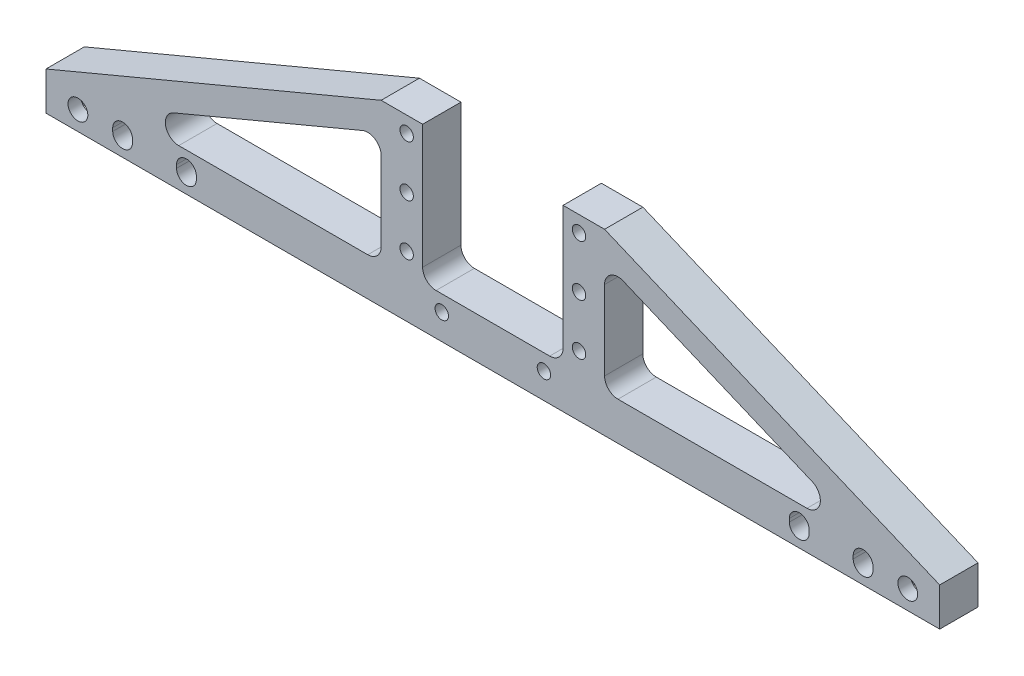
from build123d import *

# Parameters (mm, degrees)
SKETCH_1_R          = 1.05
SKETCH_1_R_2        = 1.55
EXTRUDE_1_DEPTH     = 6
SKETCH_2_R          = 1.55
CUT_EXTRUDE_1_DEPTH = 3
CUT_EXTRUDE_2_DEPTH = 75.242844773
CUT_EXTRUDE_3_DEPTH = 4
SKETCH_6_R          = 1.9
CUT_EXTRUDE_4_DEPTH = 3


with BuildPart() as part:
    # ｽｹｯﾁ1 → ﾎﾞｽ - 押し出し1 (new body)
    with BuildSketch(Plane.XY):
        with BuildLine():
            Line((-11, 4.6), (-11, 24))
            Line((-11, 24), (-17.5, 24))
            Line((-17.5, 24), (-70, 2))
            Line((-70, 2), (-70, -4))
            Line((-70, -4), (-17.5, -4))
            Line((-17.5, -4), (17.5, -4))
            Line((17.5, -4), (70, -4))
            Line((70, -4), (70, 2))
            Line((70, 2), (17.5, 24))
            Line((17.5, 24), (11, 24))
            Line((11, 24), (11, 4.6))
            ThreePointArc((11, 4.6), (10.38492424, 3.11507576), (8.9, 2.5))
            Line((8.9, 2.5), (-8.9, 2.5))
            ThreePointArc((-8.9, 2.5), (-10.38492424, 3.11507576), (-11, 4.6))
        make_face()
        with Locations((-13.5, 5.5)):
            Circle(SKETCH_1_R, mode=Mode.SUBTRACT)
        with Locations((-8, 0)):
            Circle(SKETCH_1_R, mode=Mode.SUBTRACT)
        with Locations((8, 0)):
            Circle(SKETCH_1_R, mode=Mode.SUBTRACT)
        with Locations((-13.5, 13.5)):
            Circle(SKETCH_1_R, mode=Mode.SUBTRACT)
        with Locations((-13.5, 21.5)):
            Circle(SKETCH_1_R, mode=Mode.SUBTRACT)
        with Locations((13.5, 21.5)):
            Circle(SKETCH_1_R, mode=Mode.SUBTRACT)
        with Locations((13.5, 13.5)):
            Circle(SKETCH_1_R, mode=Mode.SUBTRACT)
        with Locations((13.5, 5.5)):
            Circle(SKETCH_1_R, mode=Mode.SUBTRACT)
        with Locations((-65, -1)):
            Circle(SKETCH_1_R_2, mode=Mode.SUBTRACT)
        with Locations((65, -1)):
            Circle(SKETCH_1_R_2, mode=Mode.SUBTRACT)
        with BuildLine():
            Line((-17.5, 4.1), (-17.5, 16.506066998))
            ThreePointArc((-17.5, 16.506066998), (-18.436901101, 18.254552329), (-20.411619954, 18.442887344))
            Line((-20.411619954, 18.442887344), (-50.017007109, 6.036820345))
            ThreePointArc((-50.017007109, 6.036820345), (-51.264188108, 3.686069284), (-49.205387155, 2))
            Line((-49.205387155, 2), (-19.6, 2))
            ThreePointArc((-19.6, 2), (-18.11507576, 2.61507576), (-17.5, 4.1))
        make_face(mode=Mode.SUBTRACT)
        with BuildLine():
            Line((20.411619954, 18.442887344), (50.017007109, 6.036820345))
            ThreePointArc((50.017007109, 6.036820345), (51.264188108, 3.686069284), (49.205387155, 2))
            Line((49.205387155, 2), (19.6, 2))
            ThreePointArc((19.6, 2), (18.11507576, 2.61507576), (17.5, 4.1))
            Line((17.5, 4.1), (17.5, 16.506066998))
            ThreePointArc((17.5, 16.506066998), (18.436901101, 18.254552329), (20.411619954, 18.442887344))
        make_face(mode=Mode.SUBTRACT)
    extrude(amount=EXTRUDE_1_DEPTH)

    # ｽｹｯﾁ2 → ｶｯﾄ - 押し出し1 (cut)
    with BuildSketch(Plane.XY.offset(6)):
        with Locations((-48, -1)):
            Circle(SKETCH_2_R)
        with Locations((48, -1)):
            Circle(SKETCH_2_R)
        with Locations((-58, -1)):
            Circle(SKETCH_2_R)
        with Locations((58, -1)):
            Circle(SKETCH_2_R)
    extrude(amount=-CUT_EXTRUDE_1_DEPTH, mode=Mode.SUBTRACT)

    # ｽｹｯﾁ3 → ｶｯﾄ - 押し出し2 (cut, through all)
    with BuildSketch(Plane(origin=(0, 0, 0), x_dir=(-1, 0, 0), z_dir=(0, 0, -1))):
        with BuildLine():
            Line((-56.45, -0.75), (-56.45, -1.25))
            ThreePointArc((-56.45, -1.25), (-58, -2.8), (-59.55, -1.25))
            Line((-59.55, -1.25), (-59.55, -0.75))
            ThreePointArc((-59.55, -0.75), (-58, 0.8), (-56.45, -0.75))
        make_face()
        with BuildLine():
            Line((-46.45, -0.75), (-46.45, -1.25))
            ThreePointArc((-46.45, -1.25), (-48, -2.8), (-49.55, -1.25))
            Line((-49.55, -1.25), (-49.55, -0.75))
            ThreePointArc((-49.55, -0.75), (-48, 0.8), (-46.45, -0.75))
        make_face()
        with BuildLine():
            Line((56.45, -0.75), (56.45, -1.25))
            ThreePointArc((56.45, -1.25), (58, -2.8), (59.55, -1.25))
            Line((59.55, -1.25), (59.55, -0.75))
            ThreePointArc((59.55, -0.75), (58, 0.8), (56.45, -0.75))
        make_face()
        with BuildLine():
            Line((46.45, -0.75), (46.45, -1.25))
            ThreePointArc((46.45, -1.25), (48, -2.8), (49.55, -1.25))
            Line((49.55, -1.25), (49.55, -0.75))
            ThreePointArc((49.55, -0.75), (48, 0.8), (46.45, -0.75))
        make_face()
    extrude(amount=-CUT_EXTRUDE_2_DEPTH, mode=Mode.SUBTRACT)

    # ｽｹｯﾁ4 → ｶｯﾄ - 押し出し3 (cut)
    with BuildSketch(Plane(origin=(0, 0, 0), x_dir=(-1, 0, 0), z_dir=(0, 0, -1))):
        with BuildLine():
            Line((-68, -1), (-68, -4))
            Line((-68, -4), (-62, -4))
            Line((-62, -4), (-62, -1))
            ThreePointArc((-62, -1), (-65, 2), (-68, -1))
        make_face()
        with BuildLine():
            Line((62, -4), (62, -1))
            ThreePointArc((62, -1), (65, 2), (68, -1))
            Line((68, -1), (68, -4))
            Line((68, -4), (62, -4))
        make_face()
    extrude(amount=-CUT_EXTRUDE_3_DEPTH, mode=Mode.SUBTRACT)

    # ｽｹｯﾁ6 → ｶｯﾄ - 押し出し4 (cut)
    with BuildSketch(Plane(origin=(0, 0, 0), x_dir=(-1, 0, 0), z_dir=(0, 0, -1))):
        with Locations((-13.5, 21.5)):
            Circle(SKETCH_6_R)
        with Locations((-13.5, 13.5)):
            Circle(SKETCH_6_R)
        with Locations((-13.5, 5.5)):
            Circle(SKETCH_6_R)
        with Locations((-8, 0)):
            Circle(SKETCH_6_R)
        with Locations((8, 0)):
            Circle(SKETCH_6_R)
        with Locations((13.5, 5.5)):
            Circle(SKETCH_6_R)
        with Locations((13.5, 13.5)):
            Circle(SKETCH_6_R)
        with Locations((13.5, 21.5)):
            Circle(SKETCH_6_R)
    extrude(amount=-CUT_EXTRUDE_4_DEPTH, mode=Mode.SUBTRACT)


solid = part.part
